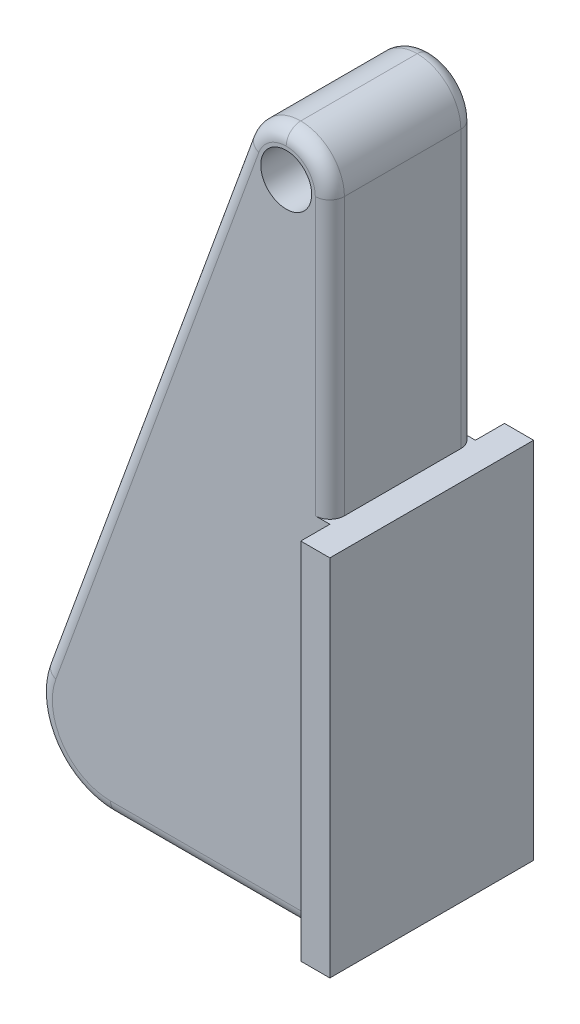
from build123d import *

# Parameters (mm, degrees)
SKIZZE1_R                       = 1.75
AUFSATZ_LINEAR_AUSTRAGEN1_DEPTH = 10
SKIZZE2_W                       = 14
SKIZZE2_H                       = 25
AUFSATZ_LINEAR_AUSTRAGEN2_DEPTH = 2
VERRUNDUNG5_R                   = 3
VERRUNDUNG6_R                   = 5
VERRUNDUNG7_R                   = 1


with BuildPart() as part:
    # Skizze1 → Aufsatz-Linear austragen1 (new body)
    with BuildSketch(Plane.XY):
        Polygon((0, 0), (0, 47), (-5.100622615, 47), (-22.207223625, 0), align=None)
        with Locations((-3, 44)):
            Circle(SKIZZE1_R, mode=Mode.SUBTRACT)
    extrude(amount=AUFSATZ_LINEAR_AUSTRAGEN1_DEPTH)

    # Skizze2 → Aufsatz-Linear austragen2 (add)
    with BuildSketch(Plane(origin=(0, 0, 0), x_dir=(0, 0, -1), z_dir=(1, 0, 0))):
        with Locations((-5, 12.5)):
            Rectangle(SKIZZE2_W, SKIZZE2_H)
    extrude(amount=AUFSATZ_LINEAR_AUSTRAGEN2_DEPTH)

    # Verrundung5
    verrundung5_edges = [part.edges().sort_by_distance(p)[0] for p in [
        (-5.100622615, 47, 5),
        (0, 47, 5),
    ]]
    fillet(verrundung5_edges, radius=VERRUNDUNG5_R - 0.0001)  # a hair under: the kernel refuses the full size

    # Verrundung6
    verrundung6_edges = [part.edges().sort_by_distance(p)[0] for p in [
        (-22.207223625, 0, 5),
    ]]
    fillet(verrundung6_edges, radius=VERRUNDUNG6_R)

    # Verrundung7
    verrundung7_edges = [part.edges().sort_by_distance(p)[0] for p in [
        (-4.720741972, 46.457474218, 0),
        (-0.878650367, 46.121349633, 0),
        (0, 34.50005, 0),
        (0, 34.50005, 10),
        (-4.720741972, 46.457474218, 10),
        (-0.878650367, 46.121349633, 10),
        (-19.162243813, 2.132117818, 0),
        (-19.162243813, 2.132117818, 10),
        (-7.533241796, 0, 10),
        (-7.533241796, 0, 0),
        (-12.792000305, 25.868113472, 0),
        (-12.792000305, 25.868113472, 10),
    ]]
    fillet(verrundung7_edges, radius=VERRUNDUNG7_R)


solid = part.part
